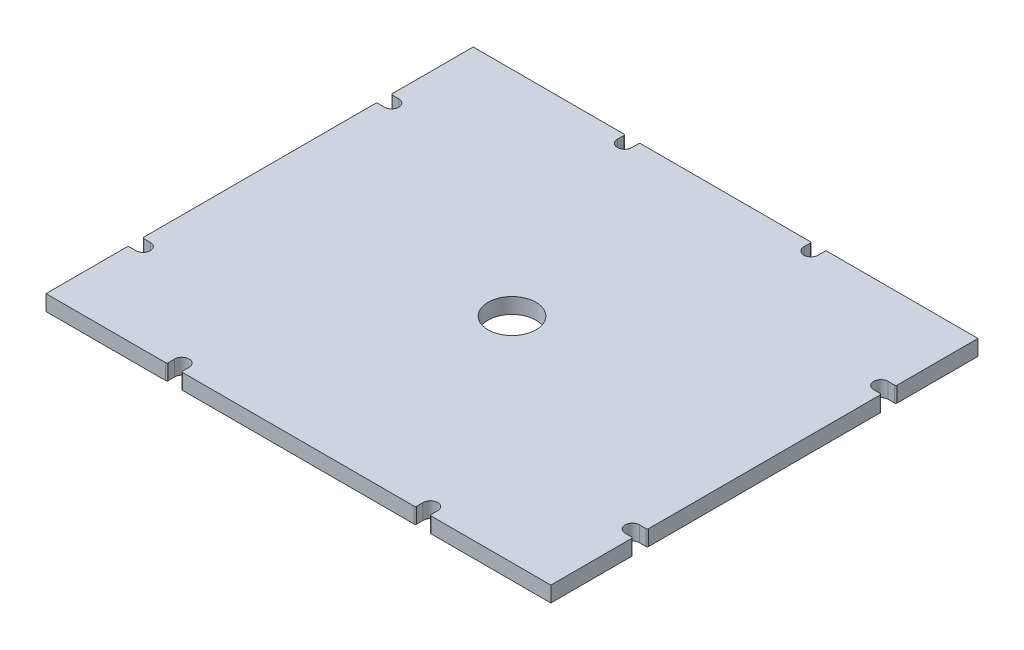
from build123d import *

# Parameters (mm, degrees)
SKETCH1_W           = 103.1875
SKETCH1_H           = 87.3125
BOSS_EXTRUDE1_DEPTH = 3.175
CUT_EXTRUDE1_DEPTH  = 68.659913007
CUT_EXTRUDE2_DEPTH  = 68.659913007
FILLET1_R           = 0.254
SKETCH10_R          = 4.8895
CUT_EXTRUDE3_DEPTH  = 68.659913007


with BuildPart() as part:
    # Sketch1 → Boss-Extrude1 (new body)
    with BuildSketch(Plane(origin=(0, 0, 0), x_dir=(1, 0, 0), z_dir=(0, 1, 0))):
        Rectangle(SKETCH1_W, SKETCH1_H)
    extrude(amount=BOSS_EXTRUDE1_DEPTH)

    # Sketch4 → Cut-Extrude1 (cut, through all)
    with BuildSketch(Plane.XZ):
        with BuildLine():
            Line((50.00625, -26.8732), (51.59375, -26.8732))
            Line((51.59375, -26.8732), (51.59375, -23.9268))
            Line((51.59375, -23.9268), (50.00625, -23.9268))
            ThreePointArc((50.00625, -23.9268), (48.53305, -25.4), (50.00625, -26.8732))
        make_face()
        with BuildLine():
            Line((50.00625, 26.8732), (51.59375, 26.8732))
            Line((51.59375, 26.8732), (51.59375, 23.9268))
            Line((51.59375, 23.9268), (50.00625, 23.9268))
            ThreePointArc((50.00625, 23.9268), (48.53305, 25.4), (50.00625, 26.8732))
        make_face()
        with BuildLine():
            Line((-50.00625, 26.8732), (-51.59375, 26.8732))
            Line((-51.59375, 26.8732), (-51.59375, 23.9268))
            Line((-51.59375, 23.9268), (-50.00625, 23.9268))
            ThreePointArc((-50.00625, 23.9268), (-48.53305, 25.4), (-50.00625, 26.8732))
        make_face()
        with BuildLine():
            Line((-50.00625, -23.9268), (-51.59375, -23.9268))
            Line((-51.59375, -23.9268), (-51.59375, -26.8732))
            Line((-51.59375, -26.8732), (-50.00625, -26.8732))
            ThreePointArc((-50.00625, -26.8732), (-48.53305, -25.4), (-50.00625, -23.9268))
        make_face()
    extrude(amount=-CUT_EXTRUDE1_DEPTH, mode=Mode.SUBTRACT)

    # Sketch9 → Cut-Extrude2 (cut, through all)
    with BuildSketch(Plane.XZ):
        with BuildLine():
            Line((17.5768, -42.06875), (17.5768, -43.65625))
            Line((17.5768, -43.65625), (20.5232, -43.65625))
            Line((20.5232, -43.65625), (20.5232, -42.06875))
            ThreePointArc((20.5232, -42.06875), (19.05, -40.59555), (17.5768, -42.06875))
        make_face()
        with BuildLine():
            Line((-20.5232, -42.06875), (-20.5232, -43.65625))
            Line((-20.5232, -43.65625), (-17.5768, -43.65625))
            Line((-17.5768, -43.65625), (-17.5768, -42.06875))
            ThreePointArc((-17.5768, -42.06875), (-19.05, -40.59555), (-20.5232, -42.06875))
        make_face()
        with BuildLine():
            Line((23.9268, 43.65625), (23.9268, 42.06875))
            ThreePointArc((23.9268, 42.06875), (25.4, 40.59555), (26.8732, 42.06875))
            Line((26.8732, 42.06875), (26.8732, 43.65625))
            Line((26.8732, 43.65625), (23.9268, 43.65625))
        make_face()
        with BuildLine():
            Line((-26.8732, 43.65625), (-26.8732, 42.06875))
            ThreePointArc((-26.8732, 42.06875), (-25.4, 40.59555), (-23.9268, 42.06875))
            Line((-23.9268, 42.06875), (-23.9268, 43.65625))
            Line((-23.9268, 43.65625), (-26.8732, 43.65625))
        make_face()
    extrude(amount=-CUT_EXTRUDE2_DEPTH, mode=Mode.SUBTRACT)

    # Fillet1
    fillet1_edges = [part.edges().sort_by_distance(p)[0] for p in [
        (20.5232, 1.5875, -43.65625),
        (17.5768, 1.5875, -43.65625),
        (-17.5768, 1.5875, -43.65625),
        (-20.5232, 1.5875, -43.65625),
        (-51.59375, 1.5875, -23.9268),
        (-51.59375, 1.5875, -26.8732),
        (-51.59375, 1.5875, 26.8732),
        (-51.59375, 1.5875, 23.9268),
        (-26.8732, 1.5875, 43.65625),
        (-23.9268, 1.5875, 43.65625),
        (26.8732, 1.5875, 43.65625),
        (23.9268, 1.5875, 43.65625),
        (51.59375, 1.5875, 26.8732),
        (51.59375, 1.5875, 23.9268),
        (51.59375, 1.5875, -23.9268),
        (51.59375, 1.5875, -26.8732),
    ]]
    fillet(fillet1_edges, radius=FILLET1_R)

    # Sketch10 → Cut-Extrude3 (cut, through all)
    with BuildSketch(Plane.XZ):
        Circle(SKETCH10_R)
    extrude(amount=-CUT_EXTRUDE3_DEPTH, mode=Mode.SUBTRACT)


solid = part.part
